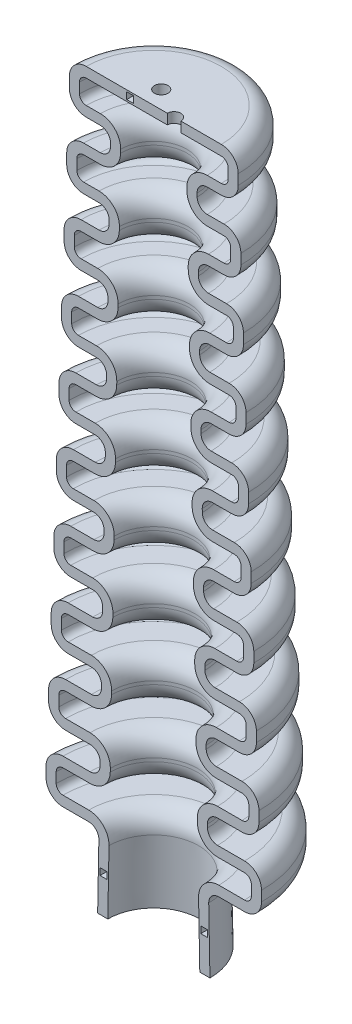
from build123d import *

# Parameters (mm, degrees)
OTHER_START              = 11.041
OTHER_1_OUTLINE_R        = 15.924075195
OTHER_1_DEPTH            = 6.5
OTHER_START_2            = 21.041
OTHER_1_2_OUTLINE_R      = 15.54256684
OTHER_1_2_DEPTH          = 6.5
OTHER_START_3            = 31.041
OTHER_1_3_OUTLINE_R      = 15.161058485
OTHER_1_3_DEPTH          = 6.5
OTHER_START_4            = 41.041
OTHER_1_4_OUTLINE_R      = 14.77955013
OTHER_1_4_DEPTH          = 6.5
OTHER_START_5            = 51.041
OTHER_1_5_OUTLINE_R      = 14.398041775
OTHER_1_5_DEPTH          = 6.5
OTHER_START_6            = 61.041
OTHER_1_6_OUTLINE_R      = 14.01653342
OTHER_1_6_DEPTH          = 6.5
OTHER_START_7            = 71.041
OTHER_1_7_OUTLINE_R      = 13.635025065
OTHER_1_7_DEPTH          = 6.5
OTHER_START_8            = 81.041
OTHER_1_8_OUTLINE_R      = 13.25451671
OTHER_1_8_DEPTH          = 6.5
OTHER_START_9            = 91.041
OTHER_1_9_OUTLINE_R      = 12.873008355
OTHER_1_9_DEPTH          = 6.5
FILLET_4_R               = 2.5
FILLET_5_R               = 1.5
SHELL_2_T                = -1.5
SKETCH_11_R              = 1
CUT_EXTRUDE_5_DEPTH      = 5
PATTERN_CIRCULAR_2_COUNT = 3
SKETCH_8_R               = 79.05648806
CUT_EXTRUDE_9_DEPTH      = 39
SKETCH_15_W              = 1
SKETCH_15_H              = 1
CUT_EXTRUDE_10_DEPTH     = 1.8


# Read off the part's stored shape, not the designer's step: 变量阵列1
with BuildPart() as part:
    # 草图3 → 旋转4 (revolve)
    with BuildSketch(Plane.XY, mode=Mode.PRIVATE) as revolve_4_sk:
        Polygon((0, 0), (-8.3, 0), (-6.2405, 107.541), (0, 107.541), align=None)
    revolve(revolve_4_sk.sketch.rotate(Axis((0, 0, 0), (0, 1, 0)), 270), axis=Axis((0, 0, 0), (0, 1, 0)))

    # 草图4 → 旋转5 (revolve)
    with BuildSketch(Plane(origin=(0, 0, 0), x_dir=(0, 0, -1), z_dir=(1, 0, 0))):
        Polygon((6.364980431, 101.041), (6.2405, 107.541), (12.4815, 107.541), (12.4815, 101.041), align=None)
    revolve(axis=Axis((0, 0, 0), (0, 1, 0)))

    # Other 1 outline → Other 1 (add)
    with BuildSketch(Plane(origin=(0, 0, 0), x_dir=(1, 0, 0), z_dir=(0, 1, 0)).offset(OTHER_START)):
        Circle(OTHER_1_OUTLINE_R)
    extrude(amount=OTHER_1_DEPTH)

    # Other 1 2 outline → Other 1 2 (add)
    with BuildSketch(Plane(origin=(0, 0, 0), x_dir=(1, 0, 0), z_dir=(0, 1, 0)).offset(OTHER_START_2)):
        Circle(OTHER_1_2_OUTLINE_R)
    extrude(amount=OTHER_1_2_DEPTH)

    # Other 1 3 outline → Other 1 3 (add)
    with BuildSketch(Plane(origin=(0, 0, 0), x_dir=(1, 0, 0), z_dir=(0, 1, 0)).offset(OTHER_START_3)):
        Circle(OTHER_1_3_OUTLINE_R)
    extrude(amount=OTHER_1_3_DEPTH)

    # Other 1 4 outline → Other 1 4 (add)
    with BuildSketch(Plane(origin=(0, 0, 0), x_dir=(1, 0, 0), z_dir=(0, 1, 0)).offset(OTHER_START_4)):
        Circle(OTHER_1_4_OUTLINE_R)
    extrude(amount=OTHER_1_4_DEPTH)

    # Other 1 5 outline → Other 1 5 (add)
    with BuildSketch(Plane(origin=(0, 0, 0), x_dir=(1, 0, 0), z_dir=(0, 1, 0)).offset(OTHER_START_5)):
        Circle(OTHER_1_5_OUTLINE_R)
    extrude(amount=OTHER_1_5_DEPTH)

    # Other 1 6 outline → Other 1 6 (add)
    with BuildSketch(Plane(origin=(0, 0, 0), x_dir=(1, 0, 0), z_dir=(0, 1, 0)).offset(OTHER_START_6)):
        Circle(OTHER_1_6_OUTLINE_R)
    extrude(amount=OTHER_1_6_DEPTH)

    # Other 1 7 outline → Other 1 7 (add)
    with BuildSketch(Plane(origin=(0, 0, 0), x_dir=(1, 0, 0), z_dir=(0, 1, 0)).offset(OTHER_START_7)):
        Circle(OTHER_1_7_OUTLINE_R)
    extrude(amount=OTHER_1_7_DEPTH)

    # Other 1 8 outline → Other 1 8 (add)
    with BuildSketch(Plane(origin=(0, 0, 0), x_dir=(1, 0, 0), z_dir=(0, 1, 0)).offset(OTHER_START_8)):
        Circle(OTHER_1_8_OUTLINE_R)
    extrude(amount=OTHER_1_8_DEPTH)

    # Other 1 9 outline → Other 1 9 (add)
    with BuildSketch(Plane(origin=(0, 0, 0), x_dir=(1, 0, 0), z_dir=(0, 1, 0)).offset(OTHER_START_9)):
        Circle(OTHER_1_9_OUTLINE_R)
    extrude(amount=OTHER_1_9_DEPTH)

    # 圆角4
    fillet_4_edges = [part.edges().sort_by_distance(p)[0] for p in [
        (0, 101.041, 12.4815),
        (0, 107.541, 12.4815),
        (-12.873008355, 91.041, 0),
        (-12.873008355, 97.541, 0),
        (-13.25451671, 81.041, 0),
        (-13.25451671, 87.541, 0),
        (-13.635025065, 71.041, 0),
        (-13.635025065, 77.541, 0),
        (-14.01653342, 61.041, 0),
        (-14.01653342, 67.541, 0),
        (-14.398041775, 51.041, 0),
        (-14.398041775, 57.541, 0),
        (-14.77955013, 41.041, 0),
        (-14.77955013, 47.541, 0),
        (-15.161058485, 31.041, 0),
        (-15.161058485, 37.541, 0),
        (-15.54256684, 21.041, 0),
        (-15.54256684, 27.541, 0),
        (-15.924075195, 11.041, 0),
        (-15.924075195, 17.541, 0),
    ]]
    fillet(fillet_4_edges, radius=FILLET_4_R)

    # 圆角5
    fillet_5_edges = [part.edges().sort_by_distance(p)[0] for p in [
        (0, 101.041, 6.364980431),
        (0, 97.541, 6.432008355),
        (0, 91.041, 6.556488786),
        (0, 87.541, 6.62351671),
        (0, 81.041, 6.747997141),
        (0, 77.541, 6.815025065),
        (0, 71.041, 6.939505496),
        (0, 67.541, 7.00653342),
        (0, 61.041, 7.131013851),
        (0, 57.541, 7.198041775),
        (0, 51.041, 7.322522205),
        (0, 47.541, 7.38955013),
        (0, 41.041, 7.51403056),
        (0, 37.541, 7.581058485),
        (0, 31.041, 7.705538915),
        (0, 27.541, 7.77256684),
        (0, 21.041, 7.89704727),
        (0, 17.541, 7.964075195),
        (0, 11.041, 8.088555625),
    ]]
    fillet(fillet_5_edges, radius=FILLET_5_R)

    # 抽壳2
    shell_2_openings = [part.faces().sort_by_distance(p)[0] for p in [
        (0, 0, 0),
    ]]
    offset(amount=SHELL_2_T, openings=shell_2_openings, kind=Kind.INTERSECTION)

    # 草图11 → 切除-拉伸5 (cut)
    with BuildSketch(Plane(origin=(0, 107.541, 0), x_dir=(1, 0, 0), z_dir=(0, 1, 0))):
        with Locations(Location((3, 0, 0), (0, 0, 270))):
            Circle(SKETCH_11_R)
    cut_extrude_5 = extrude(amount=-CUT_EXTRUDE_5_DEPTH, mode=Mode.SUBTRACT)

    # 阵列(圆周)2: 切除-拉伸5 ×3 about axis
    pattern_circular_2_axis = Axis((0, 0, 0), (0, 1, 0))
    for i in range(1, PATTERN_CIRCULAR_2_COUNT):
        add(cut_extrude_5.rotate(pattern_circular_2_axis, i * 360 / PATTERN_CIRCULAR_2_COUNT), mode=Mode.SUBTRACT)

    # 草图8 → 切除-拉伸9 (cut)
    with BuildSketch(Plane.XY):
        with Locations((0, 57.213723454)):
            Circle(SKETCH_8_R)
    extrude(amount=CUT_EXTRUDE_9_DEPTH, mode=Mode.SUBTRACT)

    # 草图15 → 切除-拉伸10 (cut)
    with BuildSketch(Plane.XY):
        with Locations((-3.5, 106.791)):
            Rectangle(SKETCH_15_W, SKETCH_15_H)
        with Locations((7.444532884, 5.5)):
            Rectangle(SKETCH_15_W, SKETCH_15_H)
        with Locations((-7.444532884, 5.5)):
            Rectangle(SKETCH_15_W, SKETCH_15_H)
    extrude(amount=-CUT_EXTRUDE_10_DEPTH, mode=Mode.SUBTRACT)


solid = part.part
